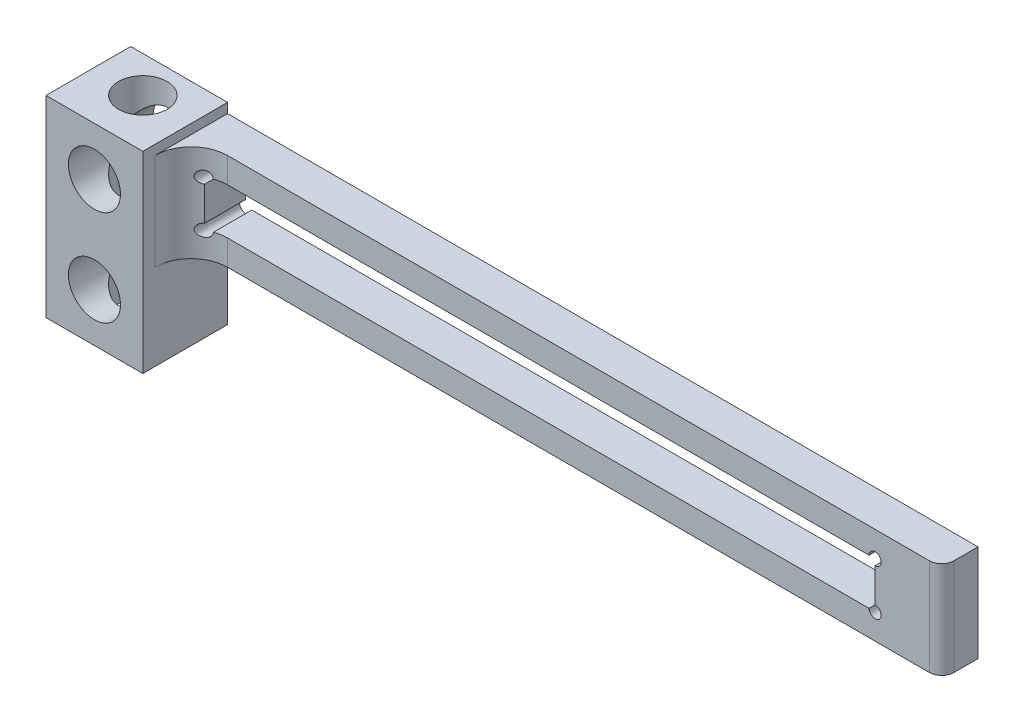
from build123d import *

# Parameters (mm, degrees)
SKIZZE1_W                    = 70
SKIZZE1_H                    = 8
SKIZZE1_W_2                  = 55
SKIZZE1_H_2                  = 3.8
BODY_DEPTH                   = 1.5
LOCHUNGSSKIZZE_R             = 0.5
RAHMENLOCHUNGEN_DEPTH        = 36.355339059
VERRUNDUNG1_R                = 1
SCHNABEL_DEPTH               = 3
SCHNABELAUFSATZSKIZZE_W      = 8
SCHNABELAUFSATZSKIZZE_H      = 15.9
SCHNABELAUFSATZ_DEPTH        = 1
LOCHUNGHORIZONTAL_DEPTH      = 39.83374821
LOCHUNGHORIZONTAL_DEPTH_BACK = 39.83374821
SKIZZE4_R                    = 2
SKIZZE5_R                    = 2.15
LOCHUNG2_DEPTH               = 38.379272331
VERRUNDUNG4_R                = 3


with BuildPart() as part:
    # Skizze1 → Body (new, symmetric)
    with BuildSketch(Plane.XY):
        Rectangle(SKIZZE1_W, SKIZZE1_H)
        with Locations((2, 0)):
            Rectangle(SKIZZE1_W_2, SKIZZE1_H_2, mode=Mode.SUBTRACT)
    extrude(amount=BODY_DEPTH, both=True)

    # Lochungsskizze → RahmenLochungen (cut, through all)
    with BuildSketch(Plane.XY.offset(1.5)):
        with Locations((-25.5, 1.9)):
            Circle(LOCHUNGSSKIZZE_R)
        with Locations((-25.5, -1.9)):
            Circle(LOCHUNGSSKIZZE_R)
        with Locations((29.5, -1.9)):
            Circle(LOCHUNGSSKIZZE_R)
        with Locations((29.5, 1.9)):
            Circle(LOCHUNGSSKIZZE_R)
    extrude(amount=-RAHMENLOCHUNGEN_DEPTH, mode=Mode.SUBTRACT)

    # Verrundung1
    verrundung1_edges = [part.edges().sort_by_distance(p)[0] for p in [
        (35, 0, 1.5),
    ]]
    fillet(verrundung1_edges, radius=VERRUNDUNG1_R)

    # Skizze2 → Schnabel (add, symmetric)
    with BuildSketch(Plane.XY.offset(1.5)):
        Polygon((-35, 0), (-35, -11.1), (-27, -11.1), (-27, 0), (-27, 4.8), (-35, 4.8), align=None)
    extrude(amount=SCHNABEL_DEPTH, both=True)

    # Schnabelaufsatzskizze → Schnabelaufsatz (add)
    with BuildSketch(Plane.XY.offset(4.5)):
        with Locations((-31, -3.15)):
            Rectangle(SCHNABELAUFSATZSKIZZE_W, SCHNABELAUFSATZSKIZZE_H)
    extrude(amount=SCHNABELAUFSATZ_DEPTH)

    # Skizze4 → lochungHorizontal (cut, two sides: drawn at the far end of the back side and taken through both)
    with BuildSketch(Plane(origin=(0, 4.8, 0), x_dir=(1, 0, 0), z_dir=(0, 1, 0)).offset(-LOCHUNGHORIZONTAL_DEPTH_BACK)):
        with Locations(Location((-31, -1.5, 0), (0, 0, 270))):
            Circle(SKIZZE4_R)
    extrude(amount=LOCHUNGHORIZONTAL_DEPTH + LOCHUNGHORIZONTAL_DEPTH_BACK, mode=Mode.SUBTRACT)

    # Skizze5 → lochung2 (cut, through all)
    with BuildSketch(Plane.XY.offset(5.5)):
        with Locations((-31, 0.8)):
            Circle(SKIZZE5_R)
        with Locations((-31, -7.1)):
            Circle(SKIZZE5_R)
    extrude(amount=-LOCHUNG2_DEPTH, mode=Mode.SUBTRACT)

    # Verrundung4
    # the kernel refuses this fillet: 3 mm, written as the material it adds along each edge
    with BuildSketch(Plane(origin=(-27, 4, 1.5), x_dir=(0, 0, 1), z_dir=(0, -1, 0))) as verrundung4_piece_1_section:
        with BuildLine():
            CenterArc((VERRUNDUNG4_R, -VERRUNDUNG4_R), VERRUNDUNG4_R, 90, 90)
            Line((0, -VERRUNDUNG4_R), (0, 0))
            Line((0, 0), (VERRUNDUNG4_R, 0))
        make_face()
    verrundung4_piece_1 = extrude(amount=8, mode=Mode.PRIVATE)
    verrundung4_piece_1 = split(verrundung4_piece_1, bisect_by=Plane(origin=(-25.5, 2.974318448, 2.280258201), z_dir=(-1, 0, 0)), keep=Keep.TOP, mode=Mode.PRIVATE)
    verrundung4_piece_1 = verrundung4_piece_1 - Plane(origin=(-25.5, 1.9, 2.280258201), x_dir=(1, 0, 0), z_dir=(0, 0, 1)) * Cylinder(0.5, 28, mode=Mode.PRIVATE)
    verrundung4_piece_1 = split(verrundung4_piece_1, bisect_by=Plane(origin=(-26.529126239, 1.9, 2.280258201), z_dir=(0, 1, 0)), keep=Keep.TOP, mode=Mode.PRIVATE)
    with BuildSketch(Plane(origin=(-27, 4, 1.5), x_dir=(0, 0, 1), z_dir=(0, -1, 0))) as verrundung4_piece_2_section:
        with BuildLine():
            CenterArc((VERRUNDUNG4_R, -VERRUNDUNG4_R), VERRUNDUNG4_R, 90, 90)
            Line((0, -VERRUNDUNG4_R), (0, 0))
            Line((0, 0), (VERRUNDUNG4_R, 0))
        make_face()
    verrundung4_piece_2 = extrude(amount=8, mode=Mode.PRIVATE)
    verrundung4_piece_2 = split(verrundung4_piece_2, bisect_by=Plane(origin=(-25.5, 3.059225234, 1.565370455), z_dir=(1, 0, 0)), keep=Keep.TOP, mode=Mode.PRIVATE)
    verrundung4_piece_2 = verrundung4_piece_2 - Plane(origin=(-25.5, 1.9, 1.565370455), x_dir=(1, 0, 0), z_dir=(0, 0, 1)) * Cylinder(0.5, 28, mode=Mode.PRIVATE)
    verrundung4_piece_2 = split(verrundung4_piece_2, bisect_by=Plane(origin=(-24.970725973, 1.9, 1.565370455), z_dir=(0, 1, 0)), keep=Keep.TOP, mode=Mode.PRIVATE)
    with BuildSketch(Plane(origin=(-27, 4, 1.5), x_dir=(0, 0, 1), z_dir=(0, -1, 0))) as verrundung4_piece_3_section:
        with BuildLine():
            CenterArc((VERRUNDUNG4_R, -VERRUNDUNG4_R), VERRUNDUNG4_R, 90, 90)
            Line((0, -VERRUNDUNG4_R), (0, 0))
            Line((0, 0), (VERRUNDUNG4_R, 0))
        make_face()
    verrundung4_piece_3 = extrude(amount=8, mode=Mode.PRIVATE)
    verrundung4_piece_3 = split(verrundung4_piece_3, bisect_by=Plane(origin=(-25.5, -6.8e-08, 2.281876588), z_dir=(-1, 0, 0)), keep=Keep.TOP, mode=Mode.PRIVATE)
    verrundung4_piece_3 = verrundung4_piece_3 - Plane(origin=(-25.5, -1.9, 2.281876588), x_dir=(1, 0, 0), z_dir=(0, 0, 1)) * Cylinder(0.5, 28, mode=Mode.PRIVATE)
    verrundung4_piece_3 = verrundung4_piece_3 - Plane(origin=(-25.5, 1.9, 2.281876588), x_dir=(1, 0, 0), z_dir=(0, 0, 1)) * Cylinder(0.5, 28, mode=Mode.PRIVATE)
    verrundung4_piece_3 = split(verrundung4_piece_3, bisect_by=Plane(origin=(-26.531548781, -1.9, 2.281876588), z_dir=(0, 1, 0)), keep=Keep.TOP, mode=Mode.PRIVATE)
    verrundung4_piece_3 = split(verrundung4_piece_3, bisect_by=Plane(origin=(-26.531548781, 1.9, 2.281876588), z_dir=(0, -1, 0)), keep=Keep.TOP, mode=Mode.PRIVATE)
    with BuildSketch(Plane(origin=(-27, 4, 1.5), x_dir=(0, 0, 1), z_dir=(0, -1, 0))) as verrundung4_piece_4_section:
        with BuildLine():
            CenterArc((VERRUNDUNG4_R, -VERRUNDUNG4_R), VERRUNDUNG4_R, 90, 90)
            Line((0, -VERRUNDUNG4_R), (0, 0))
            Line((0, 0), (VERRUNDUNG4_R, 0))
        make_face()
    verrundung4_piece_4 = extrude(amount=8, mode=Mode.PRIVATE)
    verrundung4_piece_4 = split(verrundung4_piece_4, bisect_by=Plane(origin=(-25.5, -2.974318432, 2.280258243), z_dir=(-1, 0, 0)), keep=Keep.TOP, mode=Mode.PRIVATE)
    verrundung4_piece_4 = verrundung4_piece_4 - Plane(origin=(-25.5, -1.9, 2.280258243), x_dir=(1, 0, 0), z_dir=(0, 0, 1)) * Cylinder(0.5, 28, mode=Mode.PRIVATE)
    verrundung4_piece_4 = split(verrundung4_piece_4, bisect_by=Plane(origin=(-26.529126252, -1.9, 2.280258243), z_dir=(0, -1, 0)), keep=Keep.TOP, mode=Mode.PRIVATE)
    with BuildSketch(Plane(origin=(-27, 4, 1.5), x_dir=(0, 0, 1), z_dir=(0, -1, 0))) as verrundung4_piece_5_section:
        with BuildLine():
            CenterArc((VERRUNDUNG4_R, -VERRUNDUNG4_R), VERRUNDUNG4_R, 90, 90)
            Line((0, -VERRUNDUNG4_R), (0, 0))
            Line((0, 0), (VERRUNDUNG4_R, 0))
        make_face()
    verrundung4_piece_5 = extrude(amount=8, mode=Mode.PRIVATE)
    verrundung4_piece_5 = split(verrundung4_piece_5, bisect_by=Plane(origin=(-25.5, -3.059225303, 1.565370439), z_dir=(1, 0, 0)), keep=Keep.TOP, mode=Mode.PRIVATE)
    verrundung4_piece_5 = verrundung4_piece_5 - Plane(origin=(-25.5, -1.9, 1.565370439), x_dir=(1, 0, 0), z_dir=(0, 0, 1)) * Cylinder(0.5, 28, mode=Mode.PRIVATE)
    verrundung4_piece_5 = split(verrundung4_piece_5, bisect_by=Plane(origin=(-24.970725956, -1.9, 1.565370439), z_dir=(0, -1, 0)), keep=Keep.TOP, mode=Mode.PRIVATE)
    add([verrundung4_piece_1, verrundung4_piece_2, verrundung4_piece_3, verrundung4_piece_4, verrundung4_piece_5])


solid = part.part
